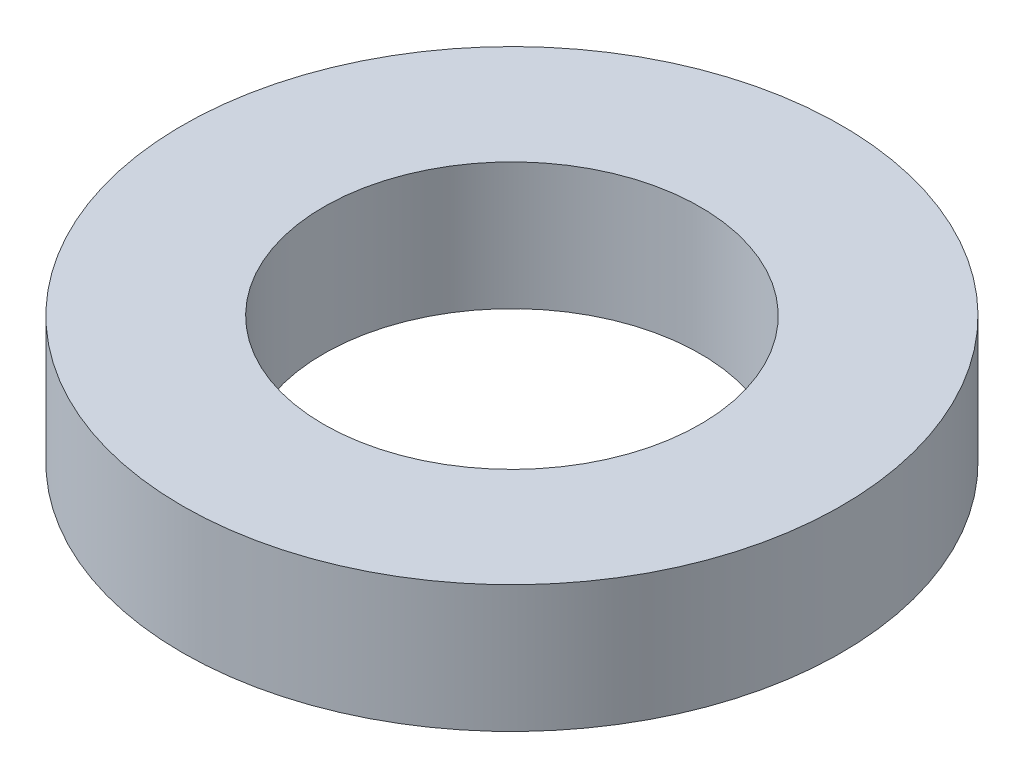
from build123d import *

# Parameters (mm, degrees)
SKETCH1_R           = 70
BOSS_EXTRUDE1_DEPTH = 27
SKETCH2_R           = 40
CUT_EXTRUDE1_DEPTH  = 103.610915599


with BuildPart() as part:
    # Sketch1 → Boss-Extrude1 (new body)
    with BuildSketch(Plane(origin=(0, 0, 0), x_dir=(1, 0, 0), z_dir=(0, 1, 0))):
        Circle(SKETCH1_R)
    extrude(amount=BOSS_EXTRUDE1_DEPTH)

    # Sketch2 → Cut-Extrude1 (cut, through all)
    with BuildSketch(Plane(origin=(0, 0, 0), x_dir=(1, 0, 0), z_dir=(0, 1, 0))):
        Circle(SKETCH2_R)
    extrude(amount=CUT_EXTRUDE1_DEPTH, mode=Mode.SUBTRACT)


solid = part.part
